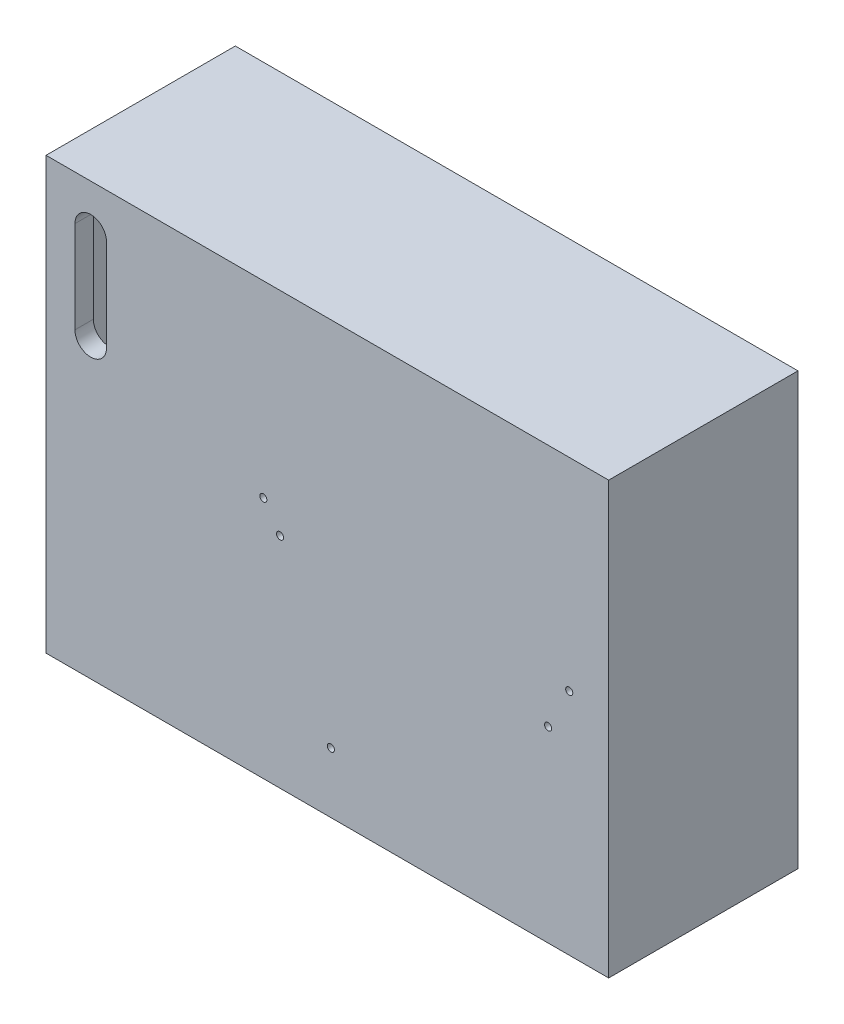
from build123d import *

# Parameters (mm, degrees)
SKELETON_W          = 214
SKELETON_H          = 164
SKELETON_R          = 1.35
BOSS_EXTRUDE1_DEPTH = 7
SKELETON_3_W        = 214
SKELETON_3_H        = 164
SKELETON_3_W_2      = 200
SKELETON_3_H_2      = 150
BOSS_EXTRUDE2_DEPTH = 65
CUT_EXTRUDE1_DEPTH  = 9


with BuildPart() as part:
    # SKELETON → Boss-Extrude1 (new body)
    with BuildSketch(Plane.XY):
        with Locations((100, 75)):
            Rectangle(SKELETON_W, SKELETON_H)
        with Locations((183.958271505, 64.282849768)):
            Circle(SKELETON_R, mode=Mode.SUBTRACT)
        with Locations((82.002495231, 76.189479555)):
            Circle(SKELETON_R, mode=Mode.SUBTRACT)
        with Locations((75.647096363, 85.48524236)):
            Circle(SKELETON_R, mode=Mode.SUBTRACT)
        with Locations((192, 80)):
            Circle(SKELETON_R, mode=Mode.SUBTRACT)
        with Locations((101.332071505, 15.946649768)):
            Circle(SKELETON_R, mode=Mode.SUBTRACT)
    extrude(amount=BOSS_EXTRUDE1_DEPTH)

    # SKELETON<3> → Boss-Extrude2 (add)
    with BuildSketch(Plane.XY):
        with Locations((100, 75)):
            Rectangle(SKELETON_3_W, SKELETON_3_H)
        with Locations((100, 75)):
            Rectangle(SKELETON_3_W_2, SKELETON_3_H_2, mode=Mode.SUBTRACT)
    extrude(amount=-BOSS_EXTRUDE2_DEPTH)

    # Sketch3 → Cut-Extrude1 (cut)
    with BuildSketch(Plane(origin=(0, 0, 0), x_dir=(-1, 0, 0), z_dir=(0, 0, -1))):
        with BuildLine():
            Line((-4, 140), (-4, 105))
            ThreePointArc((-4, 105), (-10, 99), (-16, 105))
            Line((-16, 105), (-16, 140))
            ThreePointArc((-16, 140), (-10, 146), (-4, 140))
        make_face()
    extrude(amount=-CUT_EXTRUDE1_DEPTH, mode=Mode.SUBTRACT)


solid = part.part
